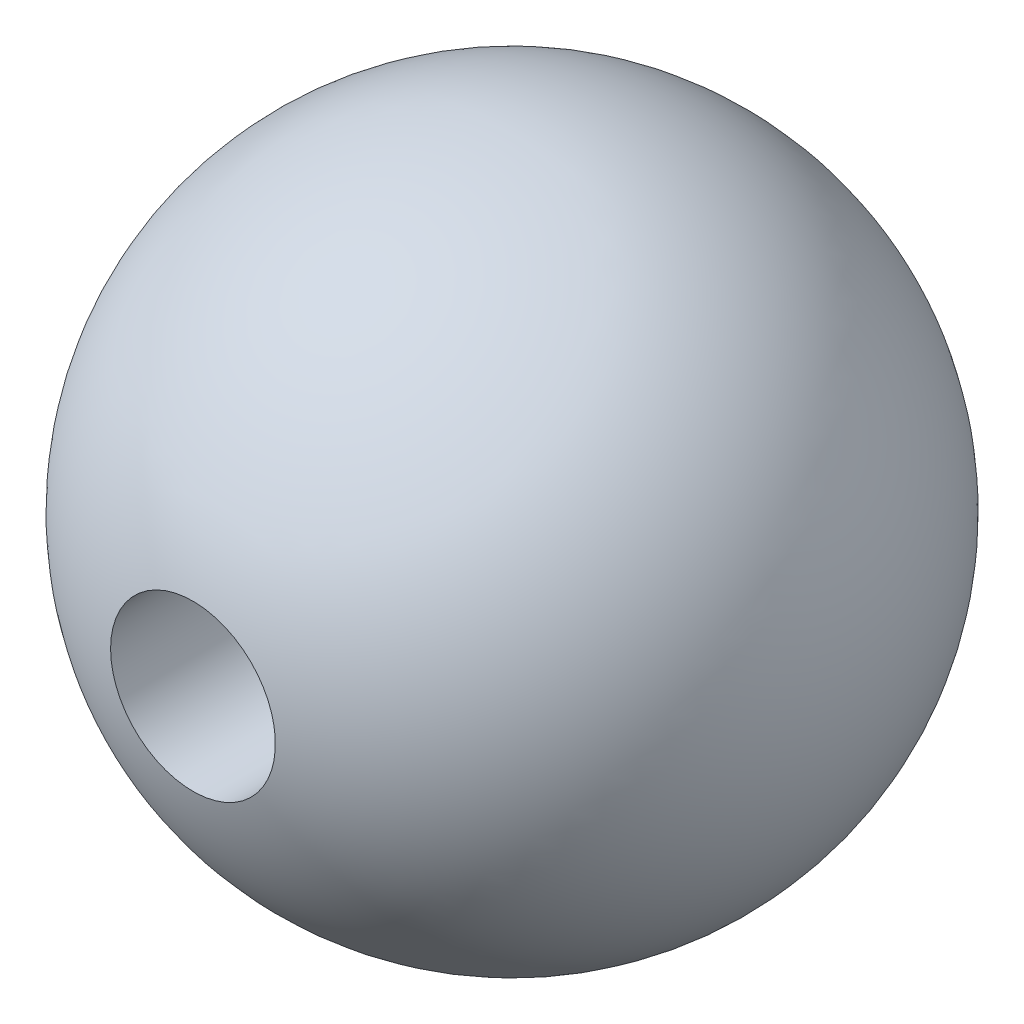
from build123d import *

# Parameters (mm, degrees)
CUT_EXTRUDE1_DEPTH      = 22.997045256
CUT_EXTRUDE1_DEPTH_BACK = 22.997045256
SKETCH2_R               = 3.175


with BuildPart() as part:
    # Sketch1 → Revolve3 (revolve)
    with BuildSketch(Plane.XY):
        with BuildLine():
            Line((0, 12.7), (0, -12.7))
            ThreePointArc((0, -12.7), (-12.7, 0), (0, 12.7))
        make_face()
    revolve(axis=Axis((0, 0, 0), (0, 1, 0)))

    # Sketch2 → Cut-Extrude1 (cut, two sides: drawn at the far end of the back side and taken through both)
    with BuildSketch(Plane.XY.offset(-CUT_EXTRUDE1_DEPTH_BACK)):
        Circle(SKETCH2_R)
    extrude(amount=CUT_EXTRUDE1_DEPTH + CUT_EXTRUDE1_DEPTH_BACK, mode=Mode.SUBTRACT)


solid = part.part
